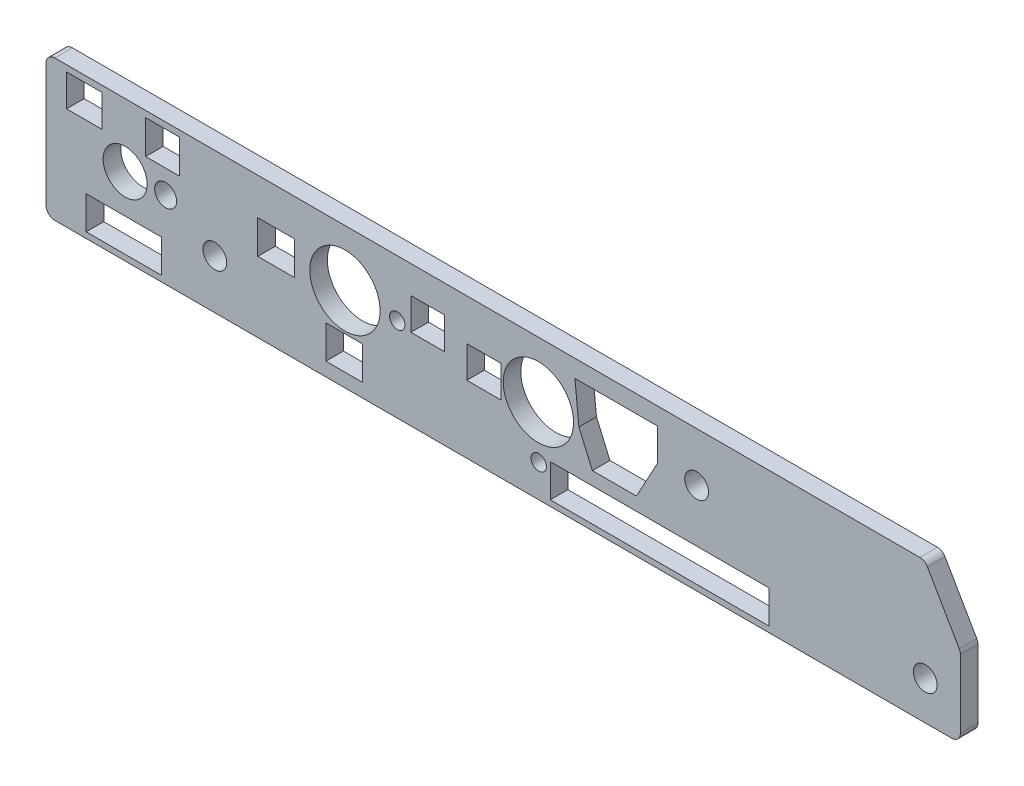
from build123d import *

# Parameters (mm, degrees)
BOSS_EXTRUDE1_DEPTH             = 3.175
F_1_2_0_5_DIAMETER_HOLE1_D      = 12.7
F_5_16_0_3125_DIAMETER_HOLE1_D  = 7.9375
F_5_32_0_15625_DIAMETER_HOLE1_D = 3.96875
F_7_64_0_10938_DIAMETER_HOLE1_D = 2.778252
F_6_CLEARANCE_HOLE1_D           = 4.3053
SKETCH12_W                      = 13.628843106
SKETCH12_H                      = 5.967659112
SKETCH12_W_2                    = 6.411201343
SKETCH12_H_2                    = 5.766049007
SKETCH12_W_3                    = 6.128947195
SKETCH12_H_3                    = 6.088625175
SKETCH12_W_4                    = 6.612811448
SKETCH12_H_4                    = 6.048303153
SKETCH12_H_5                    = 6.007981133
SKETCH12_W_5                    = 6.036712015
SKETCH12_H_6                    = 5.740571426
SKETCH12_W_6                    = 6.150612242
SKETCH12_H_7                    = 5.740571425
SKETCH12_W_7                    = 39.487797625
CUT_EXTRUDE1_DEPTH              = 168.072590885


with BuildPart() as part:
    # Sketch1 → Boss-Extrude1 (new body)
    with BuildSketch(Plane.XY):
        with BuildLine():
            Line((157.767651581, 0), (1.5875, 0))
            ThreePointArc((1.5875, 0), (0.464967985, -0.464967985), (0, -1.5875))
            Line((0, -1.5875), (0, -23.8125))
            ThreePointArc((0, -23.8125), (0.464967985, -24.935032015), (1.5875, -25.4))
            Line((1.5875, -25.4), (163.5125, -25.4))
            ThreePointArc((163.5125, -25.4), (164.635032015, -24.935032015), (165.1, -23.8125))
            Line((165.1, -23.8125), (165.1, -11.537869343))
            ThreePointArc((165.1, -11.537869343), (165.045907249, -11.126994109), (164.887315329, -10.744119343))
            Line((164.887315329, -10.744119343), (159.14246691, -0.79375))
            ThreePointArc((159.14246691, -0.79375), (158.561401581, -0.212684671), (157.767651581, 0))
        make_face()
    extrude(amount=BOSS_EXTRUDE1_DEPTH)

    # 1/2 (0.5) Diameter Hole1 (through all)
    with Locations(Plane(origin=(0, 0, 0), x_dir=(-1, 0, 0), z_dir=(0, 0, -1))):
        with Locations((-53.975, -10.16), (-88.9, -10.16)):
            Hole(F_1_2_0_5_DIAMETER_HOLE1_D / 2)

    # 5/16 (0.3125) Diameter Hole1 (through all)
    with Locations(Plane(origin=(0, 0, 0), x_dir=(-1, 0, 0), z_dir=(0, 0, -1))):
        with Locations((-14.2875, -11.43)):
            Hole(F_5_16_0_3125_DIAMETER_HOLE1_D / 2)

    # 5/32 (0.15625) Diameter Hole1 (through all)
    with Locations(Plane(origin=(0, 0, 0), x_dir=(-1, 0, 0), z_dir=(0, 0, -1))):
        with Locations((-21.598282462, -11.43)):
            Hole(F_5_32_0_15625_DIAMETER_HOLE1_D / 2)

    # 7/64 (0.10938) Diameter Hole1 (through all)
    with Locations(Plane(origin=(0, 0, 0), x_dir=(-1, 0, 0), z_dir=(0, 0, -1))):
        with Locations((-88.959471598, -19.537541197), (-63.423407807, -10.16)):
            Hole(F_7_64_0_10938_DIAMETER_HOLE1_D / 2)

    # #6 Clearance Hole1 (through all)
    with Locations(Plane(origin=(0, 0, 0), x_dir=(-1, 0, 0), z_dir=(0, 0, -1))):
        with Locations((-158.75, -18.415), (-117.475, -8.89), (-30.48, -16.51)):
            Hole(F_6_CLEARANCE_HOLE1_D / 2)

    # Sketch12 → Cut-Extrude1 (cut, through all)
    with BuildSketch(Plane(origin=(0, 0, 0), x_dir=(-1, 0, 0), z_dir=(0, 0, -1))):
        Polygon((-98.650411966, -15.990386573), (-106.620324434, -15.990386573), (-110.367372834, -9.031582403), (-110.367372834, -3.14336349), (-95.498133154, -3.14336349), (-96.2140393, -10.38700227), align=None)
        with Locations((-14.07350902, -21.369743495)):
            Rectangle(SKETCH12_W, SKETCH12_H)
        with Locations((-6.916350289, -4.011113444)):
            Rectangle(SKETCH12_W_2, SKETCH12_H_2)
        with Locations((-21.049218657, -4.172401527)):
            Rectangle(SKETCH12_W_3, SKETCH12_H_3)
        with Locations((-41.532805338, -9.676357398)):
            Rectangle(SKETCH12_W_4, SKETCH12_H_4)
        with Locations((-53.83102175, -19.938311749)):
            Rectangle(SKETCH12_W_4, SKETCH12_H_5)
        with Locations((-68.898072428, -7.877918741)):
            Rectangle(SKETCH12_W_5, SKETCH12_H_6)
        with Locations((-79.046582627, -10.338163638)):
            Rectangle(SKETCH12_W_6, SKETCH12_H_7)
        with Locations((-110.795595147, -21.369743495)):
            Rectangle(SKETCH12_W_7, SKETCH12_H)
    extrude(amount=-CUT_EXTRUDE1_DEPTH, mode=Mode.SUBTRACT)


solid = part.part
